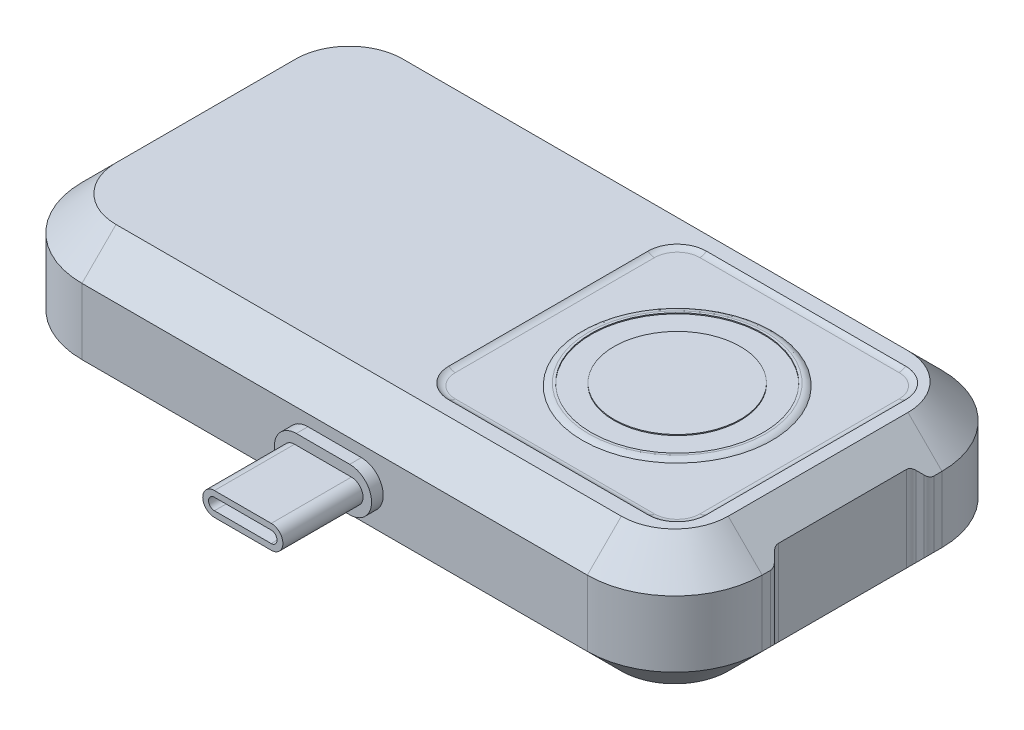
from build123d import *

# Parameters (mm, degrees)
SKETCH1_W               = 70
SKETCH1_H               = 36.5
BOSS_EXTRUDE1_DEPTH     = 6.9
BOSS_EXTRUDE2_DEPTH     = 1.2
BOSS_EXTRUDE3_DEPTH     = 8.25
FILLET1_R               = 9
SKETCH4_R               = 9.75
CUT_EXTRUDE1_DEPTH      = 0.25
SKETCH5_R               = 8.85
SKETCH5_R_2             = 6.5
CUT_EXTRUDE2_DEPTH      = 0.1
CHAMFER1_SIZE           = 3.5
CUT_EXTRUDE3_DEPTH      = 0.2
CUT_EXTRUDE4_DEPTH      = 46.16525213
CUT_EXTRUDE4_DEPTH_BACK = 46.16525213
FILLET2_R               = 1
FILLET3_R               = 1


with BuildPart() as part:
    # Sketch1 → Boss-Extrude1 (new, symmetric)
    with BuildSketch(Plane(origin=(0, 0, 0), x_dir=(1, 0, 0), z_dir=(0, 1, 0))):
        Rectangle(SKETCH1_W, SKETCH1_H)
    extrude(amount=BOSS_EXTRUDE1_DEPTH, both=True)

    # Sketch2 → Boss-Extrude2 (add)
    with BuildSketch(Plane.XY.offset(18.25)):
        with BuildLine():
            Line((2.75, -2.25), (-2.75, -2.25))
            ThreePointArc((-2.75, -2.25), (-5, 0), (-2.75, 2.25))
            Line((-2.75, 2.25), (2.75, 2.25))
            ThreePointArc((2.75, 2.25), (5, 0), (2.75, -2.25))
        make_face()
    extrude(amount=BOSS_EXTRUDE2_DEPTH)

    # Sketch3 → Boss-Extrude3 (add)
    with BuildSketch(Plane.XY.offset(19.45)):
        with BuildLine():
            Line((2.925, -1.2), (-2.925, -1.2))
            ThreePointArc((-2.925, -1.2), (-4.125, 0), (-2.925, 1.2))
            Line((-2.925, 1.2), (2.925, 1.2))
            ThreePointArc((2.925, 1.2), (4.125, 0), (2.925, -1.2))
        make_face()
        with BuildLine():
            Line((2.925, -0.6), (-2.925, -0.6))
            ThreePointArc((-2.925, -0.6), (-3.525, 0), (-2.925, 0.6))
            Line((-2.925, 0.6), (2.925, 0.6))
            ThreePointArc((2.925, 0.6), (3.525, 0), (2.925, -0.6))
        make_face(mode=Mode.SUBTRACT)
    extrude(amount=BOSS_EXTRUDE3_DEPTH)

    # Fillet1
    fillet1_edges = [part.edges().sort_by_distance(p)[0] for p in [
        (35, 0, 18.25),
        (-35, 0, 18.25),
        (-35, 0, -18.25),
        (35, 0, -18.25),
    ]]
    fillet(fillet1_edges, radius=FILLET1_R)

    # Sketch4 → Cut-Extrude1 (cut)
    with BuildSketch(Plane(origin=(0, 6.9, 0), x_dir=(1, 0, 0), z_dir=(0, 1, 0))):
        with BuildLine():
            Line((27.25, 13.25), (6.75, 13.25))
            ThreePointArc((6.75, 13.25), (4.628679656, 12.371320344), (3.75, 10.25))
            Line((3.75, 10.25), (3.75, -10.25))
            ThreePointArc((3.75, -10.25), (4.628679656, -12.371320344), (6.75, -13.25))
            Line((6.75, -13.25), (27.25, -13.25))
            ThreePointArc((27.25, -13.25), (29.371320344, -12.371320344), (30.25, -10.25))
            Line((30.25, -10.25), (30.25, 10.25))
            ThreePointArc((30.25, 10.25), (29.371320344, 12.371320344), (27.25, 13.25))
        make_face()
        with Locations(Location((17, 0, 0), (0, 0, 270))):
            Circle(SKETCH4_R, mode=Mode.SUBTRACT)
    extrude(amount=-CUT_EXTRUDE1_DEPTH, mode=Mode.SUBTRACT)

    # Sketch5 → Cut-Extrude2 (cut)
    with BuildSketch(Plane(origin=(0, 6.9, 0), x_dir=(1, 0, 0), z_dir=(0, 1, 0))):
        with Locations(Location((17, 0, 0), (0, 0, 270))):
            Circle(SKETCH5_R)
        with Locations(Location((17, 0, 0), (0, 0, 270))):
            Circle(SKETCH5_R_2, mode=Mode.SUBTRACT)
    extrude(amount=-CUT_EXTRUDE2_DEPTH, mode=Mode.SUBTRACT)

    # Chamfer1
    chamfer1_edges = [part.edges().sort_by_distance(p)[0] for p in [
        (0, -6.9, -18.25),
        (0, 6.9, -18.25),
        (35, -6.9, 0),
        (0, -6.9, 18.25),
        (-35, -6.9, 0),
        (-32.363961031, -6.9, 15.613961031),
        (-32.363961031, -6.9, -15.613961031),
        (32.363961031, -6.9, 15.613961031),
        (32.363961031, -6.9, -15.613961031),
        (35, 6.9, 0),
        (-35, 6.9, 0),
        (0, 6.9, 18.25),
        (-32.363961031, 6.9, 15.613961031),
        (-32.363961031, 6.9, -15.613961031),
        (32.363961031, 6.9, 15.613961031),
        (32.363961031, 6.9, -15.613961031),
    ]]
    chamfer(chamfer1_edges, length=CHAMFER1_SIZE)

    # Sketch6 → Cut-Extrude3 (cut)
    with BuildSketch(Plane.XZ.offset(6.9)):
        with BuildLine():
            Line((-26, -14.25), (26, -14.25))
            ThreePointArc((26, -14.25), (29.535533906, -12.785533906), (31, -9.25))
            Line((31, -9.25), (31, 9.25))
            ThreePointArc((31, 9.25), (29.535533906, 12.785533906), (26, 14.25))
            Line((26, 14.25), (-26, 14.25))
            ThreePointArc((-26, 14.25), (-29.535533906, 12.785533906), (-31, 9.25))
            Line((-31, 9.25), (-31, -9.25))
            ThreePointArc((-31, -9.25), (-29.535533906, -12.785533906), (-26, -14.25))
        make_face()
    extrude(amount=-CUT_EXTRUDE3_DEPTH, mode=Mode.SUBTRACT)

    # Sketch7 → Cut-Extrude4 (cut, two sides: drawn at the far end of the back side and taken through both)
    with BuildSketch(Plane(origin=(0, 0, 0), x_dir=(1, 0, 0), z_dir=(0, 1, 0)).offset(-CUT_EXTRUDE4_DEPTH_BACK)):
        Polygon((-34, -7), (-34, 7), (-35, 8), (-35, -8), align=None)
        Polygon((34, 7), (35, 8), (35, -8), (34, -7), align=None)
    extrude(amount=CUT_EXTRUDE4_DEPTH + CUT_EXTRUDE4_DEPTH_BACK, mode=Mode.SUBTRACT)

    # Fillet2
    fillet2_edges = [part.edges().sort_by_distance(p)[0] for p in [
        (34, 0, 7),
        (34, 0, -7),
        (35, 0, -8),
        (35, 0, 8),
        (-35, 0, -8),
        (-34, 0, -7),
        (-34, 0, 7),
        (-35, 0, 8),
    ]]
    fillet(fillet2_edges, radius=FILLET2_R)

    # Fillet3
    # the kernel refuses this fillet: 1 mm, written as the material it adds along each edge
    with BuildSketch(Plane(origin=(27.25, 6.65, -10.25), x_dir=(1, 0, 0), z_dir=(0, 0, 1))) as fillet3_piece_1:
        with BuildLine():
            CenterArc((2.338562172, 1), FILLET3_R, 270, 41.409622109)
            Line((2.338562172, 0), (2.338562172, -0.02))
            Line((2.338562172, -0.02), (3, -0.02))
            Line((3, -0.02), (3.02, 0))
            ThreePointArc((3.02, 0), (3.02, 0.125), (3.013228757, 0.235))
            Line((3.013228757, 0.235), (3, 0.25))
        make_face()
    revolve(axis=Axis((27.25, 6.65, -10.25), (0, 1, 0)), revolution_arc=90)
    with BuildSketch(Plane(origin=(30.25, 6.65, 10.25), x_dir=(0, 1, 0), z_dir=(0, 0, -1)), Plane(origin=(6.75, 6.65, 13.25), x_dir=(0, 1, 0), z_dir=(1, 0, 0)), Plane(origin=(3.75, 6.65, -10.25), x_dir=(0, 1, 0), z_dir=(0, 0, 1)), Plane(origin=(27.25, 6.65, -13.25), x_dir=(0, 1, 0), z_dir=(-1, 0, 0))) as fillet3_piece_2:
        with BuildLine():
            CenterArc((1, -0.661437828), FILLET3_R, 138.590377891, 41.409622109)
            Line((0, -0.661437828), (-0.02, -0.661437828))
            Line((-0.02, -0.661437828), (-0.02, 0))
            Line((-0.02, 0), (0, 0.02))
            ThreePointArc((0, 0.02), (0.125, 0.02), (0.235, 0.013228757))
            Line((0.235, 0.013228757), (0.25, 0))
        make_face()
    extrude(amount=20.5)
    with BuildSketch(Plane(origin=(27.25, 6.65, 10.25), x_dir=(0, 0, 1), z_dir=(-1, 0, 0))) as fillet3_piece_3:
        with BuildLine():
            CenterArc((2.338562172, 1), FILLET3_R, 270, 41.409622109)
            Line((2.338562172, 0), (2.338562172, -0.02))
            Line((2.338562172, -0.02), (3, -0.02))
            Line((3, -0.02), (3.02, 0))
            ThreePointArc((3.02, 0), (3.02, 0.125), (3.013228757, 0.235))
            Line((3.013228757, 0.235), (3, 0.25))
        make_face()
    revolve(axis=Axis((27.25, 6.65, 10.25), (0, 1, 0)), revolution_arc=90)
    with BuildSketch(Plane(origin=(6.75, 6.65, 10.25), x_dir=(-1, 0, 0), z_dir=(0, 0, -1))) as fillet3_piece_4:
        with BuildLine():
            CenterArc((2.338562172, 1), FILLET3_R, 270, 41.409622109)
            Line((2.338562172, 0), (2.338562172, -0.02))
            Line((2.338562172, -0.02), (3, -0.02))
            Line((3, -0.02), (3.02, 0))
            ThreePointArc((3.02, 0), (3.02, 0.125), (3.013228757, 0.235))
            Line((3.013228757, 0.235), (3, 0.25))
        make_face()
    revolve(axis=Axis((6.75, 6.65, 10.25), (0, 1, 0)), revolution_arc=90)
    with BuildSketch(Plane(origin=(6.75, 6.65, -10.25), x_dir=(0, 0, -1), z_dir=(1, 0, 0))) as fillet3_piece_5:
        with BuildLine():
            CenterArc((2.338562172, 1), FILLET3_R, 270, 41.409622109)
            Line((2.338562172, 0), (2.338562172, -0.02))
            Line((2.338562172, -0.02), (3, -0.02))
            Line((3, -0.02), (3.02, 0))
            ThreePointArc((3.02, 0), (3.02, 0.125), (3.013228757, 0.235))
            Line((3.013228757, 0.235), (3, 0.25))
        make_face()
    revolve(axis=Axis((6.75, 6.65, -10.25), (0, 1, 0)), revolution_arc=90)
    # the kernel refuses this fillet: 1 mm, written as the material it takes off along each edge
    with BuildSketch(Plane(origin=(17, 6.9, 0), x_dir=(0, 0, 1), z_dir=(-1, 0, 0))) as fillet3_2_piece_1:
        with BuildLine():
            CenterArc((9.088562172, -1), FILLET3_R, 48.590377891, 41.409622109)
            Line((9.088562172, 0), (9.088562172, 0.02))
            Line((9.088562172, 0.02), (9.75, 0.02))
            Line((9.75, 0.02), (9.77, 0))
            ThreePointArc((9.77, 0), (9.77, -0.125), (9.763228757, -0.235))
            Line((9.763228757, -0.235), (9.75, -0.25))
        make_face()
    revolve(axis=Axis((17, 6.9, 0), (0, 1, 0)), mode=Mode.SUBTRACT)


solid = part.part
